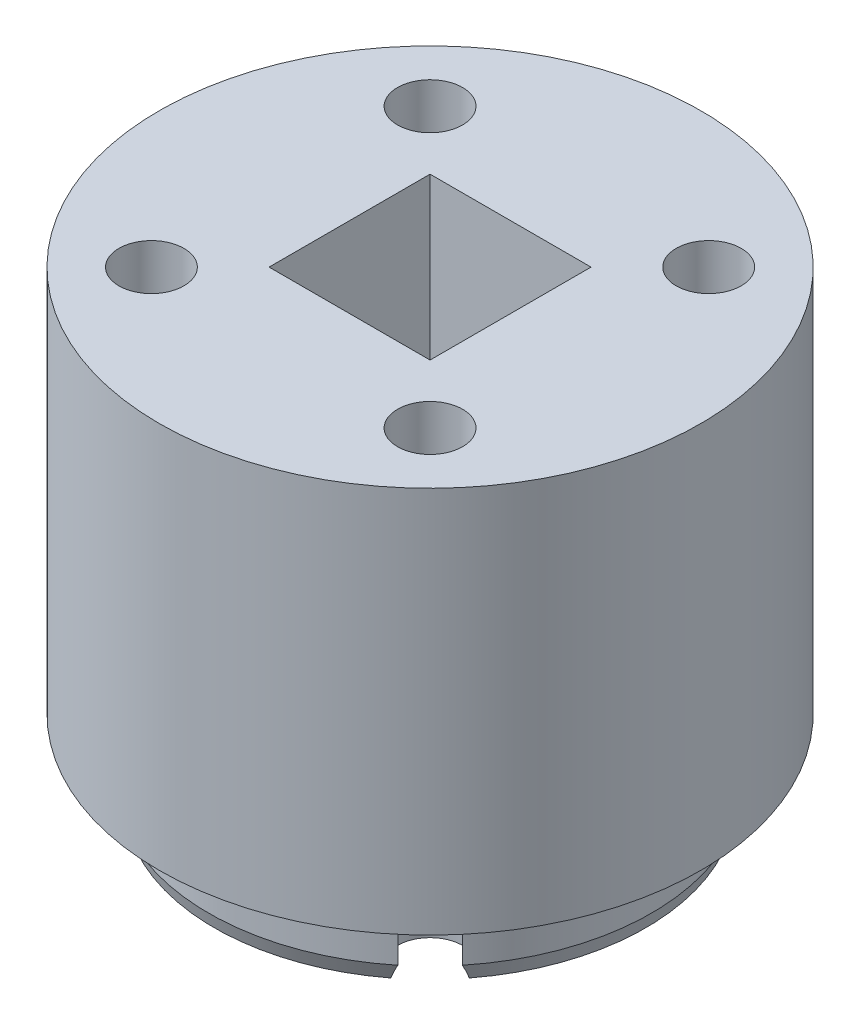
from build123d import *

# Parameters (mm, degrees)
SKETCH1_R           = 17.5
BOSS_EXTRUDE1_DEPTH = 25
SKETCH3_R           = 14.3
BOSS_EXTRUDE2_DEPTH = 5
SKETCH4_W           = 10.4
SKETCH4_H           = 10.4
CUT_EXTRUDE1_DEPTH  = 39.890872965
SKETCH6_R           = 2.1
CUT_EXTRUDE2_DEPTH  = 39.890872965
CHAMFER1_SIZE       = 0.363970234
CHAMFER1_SIZE_2     = 1


with BuildPart() as part:
    # Sketch1 → Boss-Extrude1 (new body)
    with BuildSketch(Plane(origin=(0, 0, 0), x_dir=(1, 0, 0), z_dir=(0, 1, 0))):
        with Locations(Location((0, 0, 0), (0, 0, 270))):
            Circle(SKETCH1_R)
    extrude(amount=BOSS_EXTRUDE1_DEPTH)

    # Sketch3 → Boss-Extrude2 (add)
    with BuildSketch(Plane.XZ):
        with Locations(Location((0, 0, 0), (0, 0, 90))):
            Circle(SKETCH3_R)
    extrude(amount=BOSS_EXTRUDE2_DEPTH)

    # Sketch4 → Cut-Extrude1 (cut, through all)
    with BuildSketch(Plane(origin=(0, 25, 0), x_dir=(1, 0, 0), z_dir=(0, 1, 0))):
        Rectangle(SKETCH4_W, SKETCH4_H)
    extrude(amount=-CUT_EXTRUDE1_DEPTH, mode=Mode.SUBTRACT)

    # Sketch6 → Cut-Extrude2 (cut, through all)
    with BuildSketch(Plane(origin=(0, 25, 0), x_dir=(1, 0, 0), z_dir=(0, 1, 0))):
        with Locations(Location((9, -9, 0), (0, 0, 270))):
            Circle(SKETCH6_R)
        with Locations(Location((-9, -9, 0), (0, 0, 270))):
            Circle(SKETCH6_R)
        with Locations(Location((-9, 9, 0), (0, 0, 270))):
            Circle(SKETCH6_R)
        with Locations(Location((9, 9, 0), (0, 0, 270))):
            Circle(SKETCH6_R)
    extrude(amount=-CUT_EXTRUDE2_DEPTH, mode=Mode.SUBTRACT)

    # Chamfer1
    # the kernel refuses this chamfer: 1, 0.363970234 mm, written as the material it takes off along each edge
    with BuildSketch(Plane(origin=(0, -5, 0), x_dir=(-0.7601968687413804, 0, 0.649692789521171), z_dir=(-0.649692789521171, 0, -0.7601968687413804))) as chamfer1_piece_1:
        Polygon((14.3 - CHAMFER1_SIZE, 0), (14.3, CHAMFER1_SIZE_2), (14.3, 0), align=None)
    revolve(axis=Axis((0, -5, 0), (0, 1, 0)), revolution_arc=98.963112953, mode=Mode.SUBTRACT)
    with BuildSketch(Plane(origin=(0, -5, 0), x_dir=(-0.6496927895211715, 0, 0.7601968687413799), z_dir=(0.7601968687413799, 0, 0.6496927895211715))) as chamfer1_piece_2:
        Polygon((14.3 - CHAMFER1_SIZE, 0), (14.3, -CHAMFER1_SIZE_2), (14.3, 0), align=None)
    revolve(axis=Axis((0, -5, 0), (0, -1, 0)), revolution_arc=98.963112953, mode=Mode.SUBTRACT)
    with BuildSketch(Plane(origin=(0, -5, 0), x_dir=(-0.7601968687413795, 0, -0.6496927895211719), z_dir=(-0.6496927895211719, 0, 0.7601968687413795))) as chamfer1_piece_3:
        Polygon((14.3, -CHAMFER1_SIZE_2), (14.3 - CHAMFER1_SIZE, 0), (14.3, 0), align=None)
    revolve(axis=Axis((0, -5, 0), (0, -1, 0)), revolution_arc=98.963112953, mode=Mode.SUBTRACT)
    with BuildSketch(Plane(origin=(0, -5, 0), x_dir=(0.6496927895211716, 0, -0.7601968687413798), z_dir=(-0.7601968687413798, 0, -0.6496927895211716))) as chamfer1_piece_4:
        Polygon((14.3, -CHAMFER1_SIZE_2), (14.3 - CHAMFER1_SIZE, 0), (14.3, 0), align=None)
    revolve(axis=Axis((0, -5, 0), (0, -1, 0)), revolution_arc=98.963112953, mode=Mode.SUBTRACT)


solid = part.part
